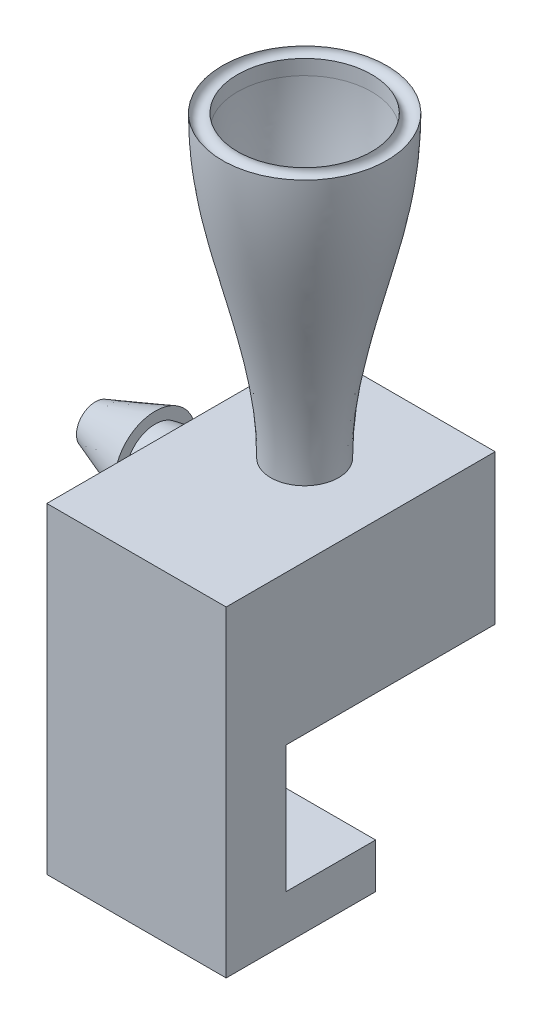
from build123d import *

# Parameters (mm, degrees)
SKETCH1_W                     = 12
SKETCH1_H                     = 10
BOSS_EXTRUDE1_DEPTH           = 18
SKETCH5_R                     = 1.27
BOSS_EXTRUDE2_DEPTH           = 8
BOSS_EXTRUDE2_DRAFT           = 10
SKETCH5_2_R                   = 1.27
BOSS_EXTRUDE3_DEPTH           = 4
BOSS_EXTRUDE3_DRAFT           = 20
SKETCH5_4_R                   = 1.27
FILLET2_R                     = 15
SKETCH7_W                     = 12
SKETCH7_H                     = 11.5
BOSS_EXTRUDE4_DEPTH           = 4
SKETCH8_W                     = 12
SKETCH8_H                     = 3
BOSS_EXTRUDE5_DEPTH           = 6
SKETCH9_R                     = 1.375
CUT_EXTRUDE1_DEPTH            = 10
CUT_EXTRUDE2_REACH            = 39.682
CUT_EXTRUDE2_END_MAJOR_RADIUS = 4.5
CUT_EXTRUDE2_END_MINOR_RADIUS = 1.27
SKETCH10_R                    = 0.5
BOSS_EXTRUDE6_REACH           = 32.347
SKETCH11_W                    = 4
SKETCH11_H                    = 8.5
FILLET3_R                     = 1.5


with BuildPart() as part:
    # Sketch1 → Boss-Extrude1 (new body)
    with BuildSketch(Plane.XY):
        Rectangle(SKETCH1_W, SKETCH1_H)
    extrude(amount=BOSS_EXTRUDE1_DEPTH)

    # Sketch3 → Revolve1 (revolve)
    with BuildSketch(Plane(origin=(0, 0, 6.75), x_dir=(-1, 0, 0), z_dir=(0, 0, -1)), mode=Mode.PRIVATE) as revolve1_sk:
        with BuildLine():
            Line((-1.290509857, 5), (-2.27, 5))
            add(Edge.make_bspline(
                [(-5.5, 24.998503325), (-5.5, 24.807864043), (-5.459624999, 21.033247585), (-3.844625, 14.985265119), (-2.27, 8.510363101), (-2.27, 5)],
                knots=[0, 0, 0, 0, 0.025, 0.5, 1, 1, 1, 1], degree=3))
            ThreePointArc((-5.5, 24.998503325), (-4.990330513, 24.488833838), (-4.480661026, 24.998503325))
            Line((-4.480661026, 24.998503325), (-4.480661026, 23.998503325))
            add(Edge.make_bspline(
                [(-4.480661026, 23.998503325), (-4.46539815, 23.604834887), (-4.415661996, 22.80814634), (-4.253459846, 21.300457939), (-3.946721612, 19.489397713), (-3.463378936, 17.378771912), (-2.733557395, 14.546016044), (-1.989493801, 11.563267181), (-1.469127638, 8.442402152), (-1.323407915, 6.810453777), (-1.290509857, 6)],
                knots=[0.046251522, 0.046251522, 0.046251522, 0.046251522, 0.102999667, 0.159747812, 0.273244102, 0.386740392, 0.500236682, 0.727229262, 0.840725552, 0.954221841, 0.954221841, 0.954221841, 0.954221841], degree=3))
            Line((-1.290509857, 6), (-1.290509857, 5))
        make_face()
    revolve(revolve1_sk.sketch.rotate(Axis((0, 24.998503325, 6.75), (0, -1, 0)), 180), axis=Axis((0, 24.998503325, 6.75), (0, -1, 0)))


with BuildPart() as boss_extrude2_tool:
    # Sketch5 → Boss-Extrude2 (with draft: the straight prism first)
    with BuildSketch(Plane.ZY.offset(14)):
        with Locations((6.75, 0)):
            Circle(SKETCH5_R)
    extrude(amount=-BOSS_EXTRUDE2_DEPTH)
    # Boss-Extrude2: the draft: its side faces are tilted about the plane it starts from
    boss_extrude2_sides = [boss_extrude2_tool.faces().sort_by_distance(p)[0] for p in [
        (-10, 0, 5.48),
    ]]
    draft(boss_extrude2_sides, Plane.ZY.offset(14), BOSS_EXTRUDE2_DRAFT)


with BuildPart() as part_1:
    add(part.part)

    # Boss-Extrude2: add boss_extrude2_tool
    add(boss_extrude2_tool.part)


with BuildPart() as boss_extrude3_tool:
    # Sketch5<2> → Boss-Extrude3 (with draft: the straight prism first)
    with BuildSketch(Plane.ZY.offset(14)):
        with Locations((6.75, 0)):
            Circle(SKETCH5_2_R)
    extrude(amount=-BOSS_EXTRUDE3_DEPTH)
    # Boss-Extrude3: the draft: its side faces are tilted about the plane it starts from
    boss_extrude3_sides = [boss_extrude3_tool.faces().sort_by_distance(p)[0] for p in [
        (-12, 0, 5.48),
    ]]
    draft(boss_extrude3_sides, Plane.ZY.offset(14), BOSS_EXTRUDE3_DRAFT)


with BuildPart() as part_2:
    add(part_1.part)

    # Boss-Extrude3: add boss_extrude3_tool
    add(boss_extrude3_tool.part)

    # Cut-Sweep1: sweep along a path in Sketch6
    with BuildLine(Plane(origin=(0, 0, 6.75), x_dir=(-1, 0, 0), z_dir=(0, 0, -1))) as cut_sweep1_path:
        Line((14, 0), (4.5, 0))
        ThreePointArc((4.5, 0), (1.318019485, 1.318019485), (0, 4.5))
        Line((0, 4.5), (0, 5))
    # Sketch5<4> → Cut-Sweep1 (sweep, cut)
    with BuildSketch(Plane.ZY.offset(14)):
        with Locations((6.75, 0)):
            Circle(SKETCH5_4_R)
    sweep(path=cut_sweep1_path.line, mode=Mode.SUBTRACT)

    # Fillet1: read off the stored shape, not the designer's step
    # Fillet1 outline → Fillet1 (revolve, cut)
    with BuildSketch(Plane.XY.offset(6.75)):
        with BuildLine():
            ThreePointArc((1.27, 4.547586565), (1.275130096, 4.774025613), (1.290509857, 5))
            Line((1.290509857, 5), (1.27, 5))
            Line((1.27, 5), (1.27, 4.547586565))
        make_face()
    revolve(axis=Axis((0, 0, 6.75), (0, 1, 0)), mode=Mode.SUBTRACT)

    # Fillet2
    # the kernel refuses this fillet: 15 mm, written as the material it adds along each edge
    with BuildSketch(Plane(origin=(0, 5, 6.75), x_dir=(-1, 0, 0), z_dir=(0, 0, 1))) as fillet2_piece_1:
        with BuildLine():
            CenterArc((-13.709490143, -0.453110518), FILLET2_R, 0, 2.595022157)
            ThreePointArc((1.275127464, 0.226032446), (1.281538275, 0.112929088), (1.290509857, 0))
            Line((1.290509857, 0), (1.290509857, -0.453110518))
        make_face()
    revolve(axis=Axis((0, 5, 6.75), (0, -1, 0)), revolution_arc=180)
    with BuildSketch(Plane(origin=(0, 5, 6.75), x_dir=(1, 0, 0), z_dir=(0, 0, -1))) as fillet2_piece_2:
        with BuildLine():
            CenterArc((-13.709490143, -0.453110518), FILLET2_R, 360, 2.595022157)
            ThreePointArc((1.275127464, 0.226032446), (1.281538275, 0.112929088), (1.290509857, 0))
            Line((1.290509857, 0), (1.290509857, -0.453110518))
        make_face()
    revolve(axis=Axis((0, 5, 6.75), (0, -1, 0)), revolution_arc=180)

    # Sketch7 → Boss-Extrude4 (add)
    with BuildSketch(Plane.XY.offset(18)):
        with Locations((0, -10.75)):
            Rectangle(SKETCH7_W, SKETCH7_H)
    extrude(amount=-BOSS_EXTRUDE4_DEPTH)

    # Sketch8 → Boss-Extrude5 (add)
    with BuildSketch(Plane(origin=(0, 0, 14), x_dir=(-1, 0, 0), z_dir=(0, 0, -1))):
        with Locations((0, -15)):
            Rectangle(SKETCH8_W, SKETCH8_H)
    extrude(amount=BOSS_EXTRUDE5_DEPTH)

    # Sketch9 → Cut-Extrude1 (cut)
    with BuildSketch(Plane.XZ.offset(16.5)):
        with Locations(Location((0, 15.8, 0), (0, 0, 270))):
            Circle(SKETCH9_R)
    extrude(amount=-CUT_EXTRUDE1_DEPTH, mode=Mode.SUBTRACT)

    # Cut-Extrude2: up to this torus (the profile starts outside it)
    cut_extrude2_end = Plane(origin=(-4.5, 4.5, 6.75), z_dir=(0, 0, 1)) * Torus(CUT_EXTRUDE2_END_MAJOR_RADIUS, CUT_EXTRUDE2_END_MINOR_RADIUS, mode=Mode.PRIVATE)
    # Sketch10 → Cut-Extrude2 (cut, up to the surface)
    with BuildSketch(Plane.XZ.offset(5), mode=Mode.PRIVATE) as cut_extrude2_sk1:
        with Locations(Location((0, 6.75, 0), (0, 0, 270))):
            Circle(SKETCH10_R)
    cut_extrude2_tool1 = extrude(cut_extrude2_sk1.sketch, amount=-CUT_EXTRUDE2_REACH, mode=Mode.PRIVATE) - cut_extrude2_end
    add(cut_extrude2_tool1.solids().sort_by_distance((0, -5, 6.75))[0], mode=Mode.SUBTRACT)

    # Sketch11 → Boss-Extrude6 (add, up to next)
    with BuildSketch(Plane(origin=(0, 0, 8), x_dir=(-1, 0, 0), z_dir=(0, 0, -1)), mode=Mode.PRIVATE) as boss_extrude6_sk1:
        with Locations((4, -9.25)):
            Rectangle(SKETCH11_W, SKETCH11_H)
    boss_extrude6_tool1 = extrude(boss_extrude6_sk1.sketch, amount=-BOSS_EXTRUDE6_REACH, mode=Mode.PRIVATE) - part_2.part
    add(boss_extrude6_tool1.solids().sort_by_distance((-4, -9.25, 8))[0])

    # Fillet3
    fillet3_edges = [part_2.edges().sort_by_distance(p)[0] for p in [
        (-2, -13.5, 11),
        (-2, -5, 11),
    ]]
    fillet(fillet3_edges, radius=FILLET3_R)


solid = part_2.part
